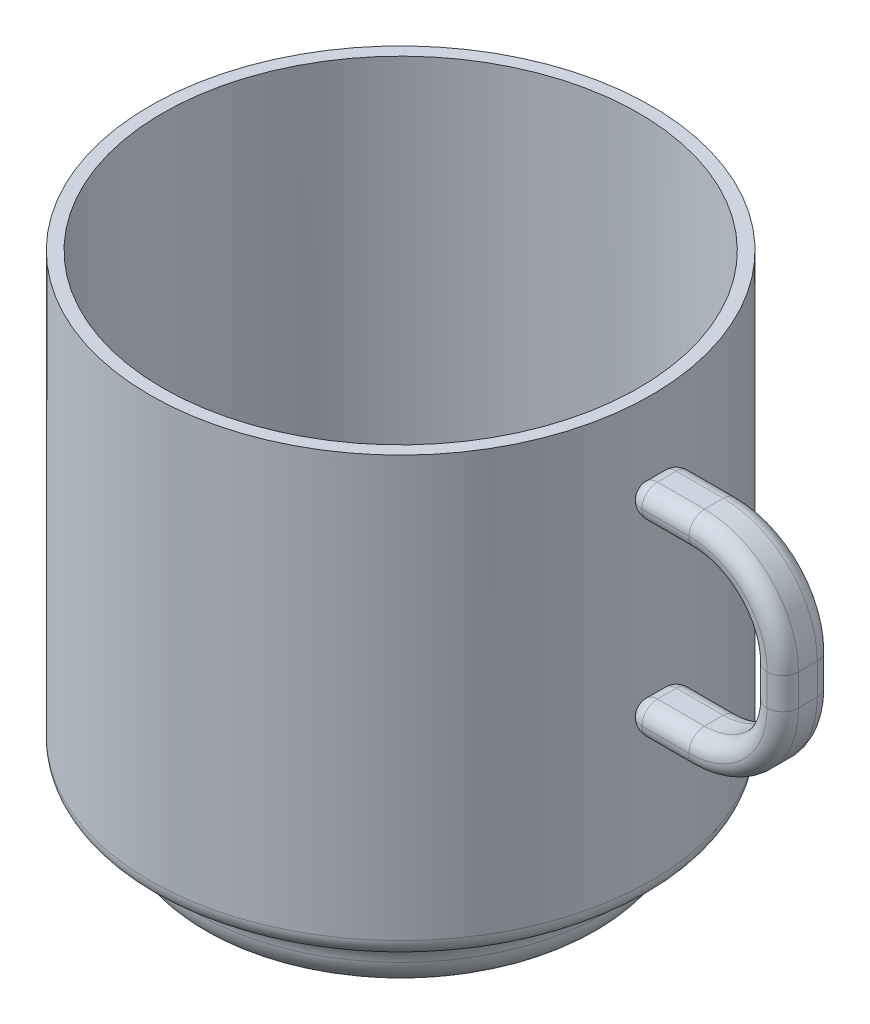
from build123d import *

# Parameters (mm, degrees)
FILLET_1_R           = 5
FILLET_2_R           = 6
FILLET_4_R           = 3
SHELL_3_T            = -2
EXTRUDE_1_DEPTH      = 4
EXTRUDE_1_DEPTH_BACK = 4
FILLET_6_R           = 2.5
FILLET_7_R           = 2.5


with BuildPart() as part:
    # 스케치1 → 회전1 (revolve)
    with BuildSketch(Plane.XY, mode=Mode.PRIVATE) as revolve_1_sk:
        Polygon((-41.765846009, 5.139464258), (-1.765846009, 5.139464258), (-1.765846009, -74.860535742), (-31.265846009, -74.860535742), (-34.265846009, -74.860535742), (-34.265846009, -71.860535742), (-34.265846009, -70.860535742), (-34.265846009, -64.860535742), (-40.265846009, -64.860535742), (-41.765846009, -64.860535742), align=None)
    revolve(revolve_1_sk.sketch.rotate(Axis((-1.765846009, 5.139464258, 0), (0, -1, 0)), 270), axis=Axis((-1.765846009, 5.139464258, 0), (0, -1, 0)))

    # 필렛1
    fillet_1_edges = [part.edges().sort_by_distance(p)[0] for p in [
        (-1.765846009, -74.860535742, -32.5),
    ]]
    fillet(fillet_1_edges, radius=FILLET_1_R)

    # 필렛2
    fillet_2_edges = [part.edges().sort_by_distance(p)[0] for p in [
        (-1.765846009, -64.860535742, -32.5),
    ]]
    fillet(fillet_2_edges, radius=FILLET_2_R)

    # 필렛4
    fillet_4_edges = [part.edges().sort_by_distance(p)[0] for p in [
        (-1.765846009, -64.860535742, -40),
    ]]
    fillet(fillet_4_edges, radius=FILLET_4_R)

    # 쉘3
    shell_3_openings = [part.faces().sort_by_distance(p)[0] for p in [
        (-1.765846009, 5.139464258, 0),
    ]]
    offset(amount=SHELL_3_T, openings=shell_3_openings, kind=Kind.INTERSECTION)


with BuildPart() as body_2:
    # 스케치2 → 보스-돌출1 (new, two sides: drawn at the far end of the back side and taken through both)
    with BuildSketch(Plane.XY.offset(-EXTRUDE_1_DEPTH_BACK)):
        with BuildLine():
            Line((58.234153991, -19.860535742), (58.234153991, -24.860535742))
            ThreePointArc((58.234153991, -24.860535742), (55.305221803, -31.931603554), (48.234153991, -34.860535742))
            Line((48.234153991, -34.860535742), (43.234153991, -34.860535742))
            Line((43.234153991, -34.860535742), (38.234153991, -34.860535742))
            Line((38.234153991, -34.860535742), (38.234153991, -39.860535742))
            Line((38.234153991, -39.860535742), (48.234153991, -39.860535742))
            ThreePointArc((48.234153991, -39.860535742), (58.840755709, -35.46713746), (63.234153991, -24.860535742))
            Line((63.234153991, -24.860535742), (63.234153991, -19.860535742))
            ThreePointArc((63.234153991, -19.860535742), (58.840755709, -9.253934024), (48.234153991, -4.860535742))
            Line((48.234153991, -4.860535742), (38.234153991, -4.860535742))
            Line((38.234153991, -4.860535742), (38.234153991, -9.860535742))
            Line((38.234153991, -9.860535742), (43.234153991, -9.860535742))
            Line((43.234153991, -9.860535742), (48.234153991, -9.860535742))
            ThreePointArc((48.234153991, -9.860535742), (55.305221803, -12.78946793), (58.234153991, -19.860535742))
        make_face()
    extrude(amount=EXTRUDE_1_DEPTH + EXTRUDE_1_DEPTH_BACK)

    # 필렛6
    fillet_6_edges = [body_2.edges().sort_by_distance(p)[0] for p in [
        (43.234153991, -39.860535742, -4),
        (58.840755709, -35.46713746, -4),
        (63.234153991, -22.360535742, -4),
        (43.234153991, -4.860535742, -4),
        (43.234153991, -39.860535742, 4),
        (58.840755709, -35.46713746, 4),
        (63.234153991, -22.360535742, 4),
        (43.234153991, -4.860535742, 4),
        (43.234153991, -9.860535742, 4),
        (43.234153991, -34.860535742, 4),
        (55.305221803, -31.931603554, 4),
        (58.234153991, -22.360535742, 4),
        (58.840755709, -9.253934024, -4),
        (58.840755709, -9.253934024, 4),
        (55.305221803, -12.78946793, 4),
    ]]
    fillet(fillet_6_edges, radius=FILLET_6_R - 0.0001)  # a hair under: the kernel refuses the full size

    # 필렛7
    fillet_7_edges = [body_2.edges().sort_by_distance(p)[0] for p in [
        (38.234153991, -9.860535742, -1.24995),
        (38.234153991, -9.128331984, 3.267796242),
        (38.234153991, -5.5927395, 3.267796242),
        (38.234153991, -4.860535742, 0),
        (38.234153991, -5.5927395, -3.267796242),
        (38.234153991, -34.860535742, -1.24995),
        (38.234153991, -35.5927395, 3.267796242),
        (38.234153991, -39.128331984, 3.267796242),
        (38.234153991, -39.860535742, 0),
        (38.234153991, -39.128331984, -3.267796242),
        (43.234153991, -9.860535742, -4),
        (55.305221803, -12.78946793, -4),
        (58.234153991, -22.360535742, -4),
        (55.305221803, -31.931603554, -4),
        (43.234153991, -34.860535742, -4),
    ]]
    fillet(fillet_7_edges, radius=FILLET_7_R - 0.0001)  # a hair under: the kernel refuses the full size


solid = Compound([part.part, body_2.part])
